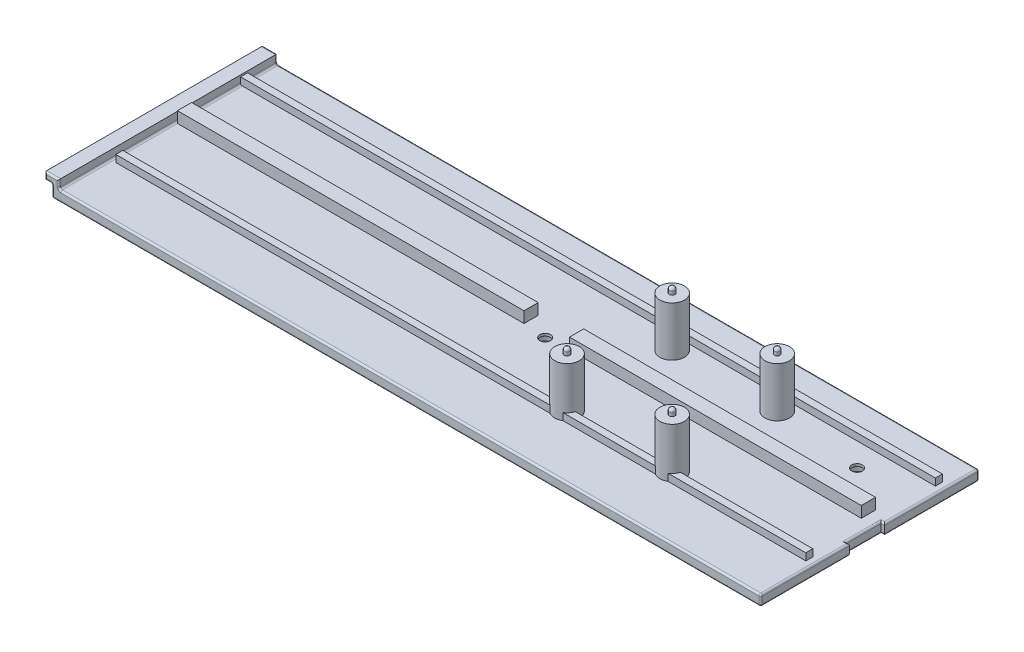
from build123d import *

# Parameters (mm, degrees)
SKETCH1_W                          = 202.32
SKETCH1_H                          = 62.3
LID_DEPTH                          = 2
SKETCH3_W                          = 2
SKETCH3_H                          = 62.3
LIP_VERTICAL_DEPTH                 = 2.5
SKETCH4_W                          = 62.3
SKETCH4_H                          = 2
LIP_HORIZONTAL_DEPTH               = 2
SKETCH11_W                         = 202.32
SKETCH11_H                         = 62.3
FATTEN_BELOW_DEPTH                 = 1
SKETCH19_W                         = 1
SKETCH19_H                         = 10
OPENER_HOLE_DEPTH                  = 214.147183995
FILLET1_R                          = 0.5
SKETCH2_W                          = 196.97
SKETCH2_H                          = 2
SKETCH2_W_2                        = 198.82
STIFFENERS_DEPTH                   = 2
SKETCH20_W                         = 195.199890547
SKETCH20_H                         = 4.052325692
CENTER_STIFFENER_DEPTH             = 3.161676403
SKETCH5_R                          = 1.524
MOUNTING_SCREW_HOLES_DEPTH         = 214.099667392
SKETCH6_R                          = 3.048
MOUNTING_SCREW_COUNTERSINK_DEPTH   = 2.286
SKETCH21_W                         = 13
SKETCH21_H                         = 13
CLEARANCE_FOR_ENCLOSURE_SNAP_DEPTH = 214.099667392
SKETCH7_R                          = 3.5
TRELLIS_BOSSES_DEPTH               = 14.161676403
SKETCH8_R                          = 0.8
TRELLIS_DOME_MOUNT_DEPTH           = 1
DOME1_FACE_RADIUS                  = 0.8
DOME1_HEIGHT                       = 0.8
DOME2_FACE_RADIUS                  = 0.8
DOME2_HEIGHT                       = 0.8
DOME3_FACE_RADIUS                  = 0.8
DOME3_HEIGHT                       = 0.8
DOME4_FACE_RADIUS                  = 0.8
DOME4_HEIGHT                       = 0.8
BOTTOM_SURFACE_DEPTH               = 12
FILL_START                         = 74.825598753
FILL_BOTTOM_DEPTH                  = 12
FILL_START_2                       = 83.485852791
FILL_BOTTOM_2_DEPTH                = 12
FILL_START_3                       = 92.146106828
FILL_BOTTOM_3_DEPTH                = 12
FILL_START_4                       = 48.844836639
FILL_BOTTOM_4_DEPTH                = 12
FILL_START_5                       = 57.505090677
FILL_BOTTOM_5_DEPTH                = 12
FILL_START_6                       = 66.165344715
FILL_BOTTOM_6_DEPTH                = 12


# Read off the part's stored shape, not the designer's step: fill bottom
with BuildPart() as part:
    # Sketch1 → lid (new body)
    with BuildSketch(Plane.XZ.offset(-34)):
        with Locations((80.631906678, 79.994836639)):
            Rectangle(SKETCH1_W, SKETCH1_H)
    extrude(amount=-LID_DEPTH)

    # Sketch3 → lip vertical (add)
    with BuildSketch(Plane(origin=(0, 36, 0), x_dir=(1, 0, 0), z_dir=(0, 1, 0))):
        with Locations((-19.528093322, -79.994836639)):
            Rectangle(SKETCH3_W, SKETCH3_H)
    extrude(amount=LIP_VERTICAL_DEPTH)

    # Sketch4 → lip horizontal (add)
    with BuildSketch(Plane.ZY.offset(20.528093322)):
        with Locations((79.994836639, 37.5)):
            Rectangle(SKETCH4_W, SKETCH4_H)
    extrude(amount=LIP_HORIZONTAL_DEPTH)

    # Sketch11 → fatten below (add)
    with BuildSketch(Plane.XZ.offset(-34)):
        with Locations((80.631906678, 79.994836639)):
            Rectangle(SKETCH11_W, SKETCH11_H)
    extrude(amount=FATTEN_BELOW_DEPTH)

    # Sketch19 → opener hole (cut, through all)
    with BuildSketch(Plane.XZ.offset(-33)):
        with Locations((181.291906678, 80.801378607)):
            Rectangle(SKETCH19_W, SKETCH19_H)
    extrude(amount=-OPENER_HOLE_DEPTH, mode=Mode.SUBTRACT)

    # Fillet1
    fillet1_edges = [part.edges().sort_by_distance(p)[0] for p in [
        (81.631906678, 36, 48.844836639),
        (-18.528093322, 36, 79.994836639),
        (-18.528093322, 37.25, 111.144836639),
        (-18.528093322, 37.25, 48.844836639),
        (-20.528093322, 38.5, 111.144836639),
        (-20.528093322, 38.5, 48.844836639),
        (181.791906678, 34.5, 48.844836639),
        (181.791906678, 36, 62.323107623),
        (181.791906678, 34.5, 111.144836639),
        (81.631906678, 36, 111.144836639),
        (-20.528093322, 34.75, 111.144836639),
        (-20.528093322, 34.75, 48.844836639),
        (-20.528093322, 36.5, 79.994836639),
        (-21.528093322, 36.5, 48.844836639),
        (-21.528093322, 36.5, 111.144836639),
        (-22.528093322, 37.5, 48.844836639),
        (-22.528093322, 37.5, 111.144836639),
        (-20.528093322, 33, 79.994836639),
        (80.631906678, 33, 48.844836639),
        (181.791906678, 33, 62.323107623),
        (80.631906678, 33, 111.144836639),
        (181.791906678, 33, 98.473107623),
        (181.791906678, 36, 98.473107623),
        (181.291906678, 36, 75.801378607),
        (180.791906678, 36, 80.801378607),
        (181.291906678, 36, 85.801378607),
        (181.291906678, 33, 85.801378607),
        (180.791906678, 33, 80.801378607),
        (181.291906678, 33, 75.801378607),
    ]]
    fillet(fillet1_edges, radius=FILLET1_R)

    # Sketch2 → stiffeners (add)
    with BuildSketch(Plane.XZ.offset(-36)):
        with Locations((81.306906678, 95.288805171)):
            Rectangle(SKETCH2_W, SKETCH2_H)
        with Locations((80.381906678, 58.308383304)):
            Rectangle(SKETCH2_W_2, SKETCH2_H)
    extrude(amount=-STIFFENERS_DEPTH)

    # Sketch20 → center stiffener (add)
    with BuildSketch(Plane(origin=(0, 36, 0), x_dir=(1, 0, 0), z_dir=(0, 1, 0))):
        with Locations((79.571851952, -75.814480957)):
            Rectangle(SKETCH20_W, SKETCH20_H)
    extrude(amount=CENTER_STIFFENER_DEPTH)

    # Sketch5 → mounting screw holes (cut, through all)
    with BuildSketch(Plane(origin=(0, 36, 0), x_dir=(1, 0, 0), z_dir=(0, 1, 0))):
        with Locations(Location((164.141906678, -66, 0), (0, 0, 270))):
            Circle(SKETCH5_R)
        with Locations(Location((87.4, -78.296377284, 0), (0, 0, 270))):
            Circle(SKETCH5_R)
    extrude(amount=-MOUNTING_SCREW_HOLES_DEPTH, mode=Mode.SUBTRACT)

    # Sketch6 → mounting screw countersink (cut)
    with BuildSketch(Plane.XZ.offset(-33)):
        with Locations(Location((164.141906678, 66, 0), (0, 0, 270))):
            Circle(SKETCH6_R)
        with Locations(Location((87.4, 78.296377284, 0), (0, 0, 270))):
            Circle(SKETCH6_R)
    extrude(amount=-MOUNTING_SCREW_COUNTERSINK_DEPTH, mode=Mode.SUBTRACT)

    # Sketch21 → clearance for enclosure snap (cut, through all)
    with BuildSketch(Plane(origin=(0, 36, 0), x_dir=(1, 0, 0), z_dir=(0, 1, 0))):
        with Locations((87.4, -78.296377284)):
            Rectangle(SKETCH21_W, SKETCH21_H)
    extrude(amount=CLEARANCE_FOR_ENCLOSURE_SNAP_DEPTH, mode=Mode.SUBTRACT)

    # Sketch7 → Trellis bosses (add)
    with BuildSketch(Plane(origin=(0, 36, 0), x_dir=(1, 0, 0), z_dir=(0, 1, 0))):
        with Locations(Location((108.641906678, -63.296377284, 0), (0, 0, 90))):
            Circle(SKETCH7_R)
        with Locations(Location((138.641906678, -63.296377284, 0), (0, 0, 90))):
            Circle(SKETCH7_R)
        with Locations(Location((108.641906678, -93.296377284, 0), (0, 0, 90))):
            Circle(SKETCH7_R)
        with Locations(Location((138.641906678, -93.296377284, 0), (0, 0, 90))):
            Circle(SKETCH7_R)
    extrude(amount=TRELLIS_BOSSES_DEPTH)

    # Sketch8 → trellis dome mount (add)
    with BuildSketch(Plane(origin=(0, 50.161676403, 0), x_dir=(1, 0, 0), z_dir=(0, 1, 0))):
        with Locations(Location((108.641906678, -63.296377284, 0), (0, 0, 270))):
            Circle(SKETCH8_R)
        with Locations(Location((138.641906678, -63.296377284, 0), (0, 0, 270))):
            Circle(SKETCH8_R)
        with Locations(Location((108.641906678, -93.296377284, 0), (0, 0, 270))):
            Circle(SKETCH8_R)
        with Locations(Location((138.641906678, -93.296377284, 0), (0, 0, 270))):
            Circle(SKETCH8_R)
    extrude(amount=TRELLIS_DOME_MOUNT_DEPTH)

    # Dome1: a dome of height H over a round flat face of radius A is a cap of a sphere of radius (A * A + H * H) / (2 * H)
    dome1_r = (DOME1_FACE_RADIUS * DOME1_FACE_RADIUS + DOME1_HEIGHT * DOME1_HEIGHT) / (2 * DOME1_HEIGHT)
    dome1_base = Plane((108.641906678, 51.161676403, 63.296377284), z_dir=(0, 1, 0))
    with Locations(dome1_base.offset(DOME1_HEIGHT - dome1_r)):
        dome1_ball = Sphere(dome1_r, mode=Mode.PRIVATE)
    add(split(dome1_ball, bisect_by=dome1_base, keep=Keep.TOP, mode=Mode.PRIVATE))

    # Dome2: a dome of height H over a round flat face of radius A is a cap of a sphere of radius (A * A + H * H) / (2 * H)
    dome2_r = (DOME2_FACE_RADIUS * DOME2_FACE_RADIUS + DOME2_HEIGHT * DOME2_HEIGHT) / (2 * DOME2_HEIGHT)
    dome2_base = Plane((108.641906678, 51.161676403, 93.296377284), z_dir=(0, 1, 0))
    with Locations(dome2_base.offset(DOME2_HEIGHT - dome2_r)):
        dome2_ball = Sphere(dome2_r, mode=Mode.PRIVATE)
    add(split(dome2_ball, bisect_by=dome2_base, keep=Keep.TOP, mode=Mode.PRIVATE))

    # Dome3: a dome of height H over a round flat face of radius A is a cap of a sphere of radius (A * A + H * H) / (2 * H)
    dome3_r = (DOME3_FACE_RADIUS * DOME3_FACE_RADIUS + DOME3_HEIGHT * DOME3_HEIGHT) / (2 * DOME3_HEIGHT)
    dome3_base = Plane((138.641906678, 51.161676403, 93.296377284), z_dir=(0, 1, 0))
    with Locations(dome3_base.offset(DOME3_HEIGHT - dome3_r)):
        dome3_ball = Sphere(dome3_r, mode=Mode.PRIVATE)
    add(split(dome3_ball, bisect_by=dome3_base, keep=Keep.TOP, mode=Mode.PRIVATE))

    # Dome4: a dome of height H over a round flat face of radius A is a cap of a sphere of radius (A * A + H * H) / (2 * H)
    dome4_r = (DOME4_FACE_RADIUS * DOME4_FACE_RADIUS + DOME4_HEIGHT * DOME4_HEIGHT) / (2 * DOME4_HEIGHT)
    dome4_base = Plane((138.641906678, 51.161676403, 63.296377284), z_dir=(0, 1, 0))
    with Locations(dome4_base.offset(DOME4_HEIGHT - dome4_r)):
        dome4_ball = Sphere(dome4_r, mode=Mode.PRIVATE)
    add(split(dome4_ball, bisect_by=dome4_base, keep=Keep.TOP, mode=Mode.PRIVATE))

    # Sketch15 → bottom surface (cut)
    with BuildSketch(Plane(origin=(0, 0, 48.844836639), x_dir=(-1, 0, 0), z_dir=(0, 0, -1))):
        Polygon((-56.203002414, 33.5), (-54.454472185, 31.287500136), (-58.415502277, 31.287500136), align=None)
    extrude(amount=-BOTTOM_SURFACE_DEPTH, mode=Mode.SUBTRACT)

    # fill bottom outline → fill bottom (cut)
    with BuildSketch(Plane.XY.offset(FILL_START)):
        Polygon((-19.192145685, 33), (-18.296997586, 33), (-18.796997586, 33.5), align=None)
        Polygon((-9.192145685, 33), (-8.296997586, 33), (-8.796997586, 33.5), align=None)
        Polygon((0.807854315, 33), (1.703002414, 33), (1.203002414, 33.5), align=None)
        Polygon((10.807854315, 33), (11.703002414, 33), (11.203002414, 33.5), align=None)
        Polygon((20.807854315, 33), (21.703002414, 33), (21.203002414, 33.5), align=None)
        Polygon((30.807854315, 33), (31.703002414, 33), (31.203002414, 33.5), align=None)
        Polygon((40.807854315, 33), (41.703002414, 33), (41.203002414, 33.5), align=None)
        Polygon((50.807854315, 33), (51.703002414, 33), (51.203002414, 33.5), align=None)
        Polygon((171.203002414, 33.5), (170.807854315, 33), (171.703002414, 33), align=None)
        Polygon((161.203002414, 33.5), (160.807854315, 33), (161.703002414, 33), align=None)
        Polygon((151.203002414, 33.5), (150.807854315, 33), (151.703002414, 33), align=None)
        Polygon((141.203002414, 33.5), (140.807854315, 33), (141.703002414, 33), align=None)
        Polygon((131.203002414, 33.5), (130.807854315, 33), (131.703002414, 33), align=None)
        Polygon((121.203002414, 33.5), (120.807854315, 33), (121.703002414, 33), align=None)
        Polygon((111.203002414, 33.5), (110.807854315, 33), (111.703002414, 33), align=None)
        Polygon((101.203002414, 33.5), (100.807854315, 33), (101.703002414, 33), align=None)
        Polygon((91.203002414, 33.5), (90.807854315, 33), (91.703002414, 33), align=None)
        Polygon((81.203002414, 33.5), (80.807854315, 33), (81.703002414, 33), align=None)
        Polygon((71.203002414, 33.5), (70.807854315, 33), (71.703002414, 33), align=None)
        Polygon((61.203002414, 33.5), (60.807854315, 33), (61.703002414, 33), align=None)
    extrude(amount=FILL_BOTTOM_DEPTH, mode=Mode.SUBTRACT)

    # fill bottom 2 outline → fill bottom 2 (cut)
    with BuildSketch(Plane.XY.offset(FILL_START_2)):
        Polygon((55.807854315, 33), (56.703002414, 33), (56.203002414, 33.5), align=None)
        Polygon((-14.192145685, 33), (-13.296997586, 33), (-13.796997586, 33.5), align=None)
        Polygon((-4.192145685, 33), (-3.296997586, 33), (-3.796997586, 33.5), align=None)
        Polygon((5.807854315, 33), (6.703002414, 33), (6.203002414, 33.5), align=None)
        Polygon((15.807854315, 33), (16.703002414, 33), (16.203002414, 33.5), align=None)
        Polygon((25.807854315, 33), (26.703002414, 33), (26.203002414, 33.5), align=None)
        Polygon((35.807854315, 33), (36.703002414, 33), (36.203002414, 33.5), align=None)
        Polygon((45.807854315, 33), (46.703002414, 33), (46.203002414, 33.5), align=None)
        Polygon((176.203002414, 33.5), (175.807854315, 33), (176.703002414, 33), align=None)
        Polygon((166.203002414, 33.5), (165.807854315, 33), (166.703002414, 33), align=None)
        Polygon((156.203002414, 33.5), (155.807854315, 33), (156.703002414, 33), align=None)
        Polygon((146.203002414, 33.5), (145.807854315, 33), (146.703002414, 33), align=None)
        Polygon((136.203002414, 33.5), (135.807854315, 33), (136.703002414, 33), align=None)
        Polygon((126.203002414, 33.5), (125.807854315, 33), (126.703002414, 33), align=None)
        Polygon((116.203002414, 33.5), (115.807854315, 33), (116.703002414, 33), align=None)
        Polygon((106.203002414, 33.5), (105.807854315, 33), (106.703002414, 33), align=None)
        Polygon((96.203002414, 33.5), (95.807854315, 33), (96.703002414, 33), align=None)
        Polygon((86.203002414, 33.5), (85.807854315, 33), (86.703002414, 33), align=None)
        Polygon((76.203002414, 33.5), (75.807854315, 33), (76.703002414, 33), align=None)
        Polygon((66.203002414, 33.5), (65.807854315, 33), (66.703002414, 33), align=None)
    extrude(amount=FILL_BOTTOM_2_DEPTH, mode=Mode.SUBTRACT)

    # fill bottom 3 outline → fill bottom 3 (cut)
    with BuildSketch(Plane.XY.offset(FILL_START_3)):
        Polygon((-19.192145685, 33), (-18.296997586, 33), (-18.796997586, 33.5), align=None)
        Polygon((-9.192145685, 33), (-8.296997586, 33), (-8.796997586, 33.5), align=None)
        Polygon((0.807854315, 33), (1.703002414, 33), (1.203002414, 33.5), align=None)
        Polygon((10.807854315, 33), (11.703002414, 33), (11.203002414, 33.5), align=None)
        Polygon((20.807854315, 33), (21.703002414, 33), (21.203002414, 33.5), align=None)
        Polygon((30.807854315, 33), (31.703002414, 33), (31.203002414, 33.5), align=None)
        Polygon((40.807854315, 33), (41.703002414, 33), (41.203002414, 33.5), align=None)
        Polygon((50.807854315, 33), (51.703002414, 33), (51.203002414, 33.5), align=None)
        Polygon((171.203002414, 33.5), (170.807854315, 33), (171.703002414, 33), align=None)
        Polygon((161.203002414, 33.5), (160.807854315, 33), (161.703002414, 33), align=None)
        Polygon((151.203002414, 33.5), (150.807854315, 33), (151.703002414, 33), align=None)
        Polygon((141.203002414, 33.5), (140.807854315, 33), (141.703002414, 33), align=None)
        Polygon((131.203002414, 33.5), (130.807854315, 33), (131.703002414, 33), align=None)
        Polygon((121.203002414, 33.5), (120.807854315, 33), (121.703002414, 33), align=None)
        Polygon((111.203002414, 33.5), (110.807854315, 33), (111.703002414, 33), align=None)
        Polygon((101.203002414, 33.5), (100.807854315, 33), (101.703002414, 33), align=None)
        Polygon((91.203002414, 33.5), (90.807854315, 33), (91.703002414, 33), align=None)
        Polygon((81.203002414, 33.5), (80.807854315, 33), (81.703002414, 33), align=None)
        Polygon((71.203002414, 33.5), (70.807854315, 33), (71.703002414, 33), align=None)
        Polygon((61.203002414, 33.5), (60.807854315, 33), (61.703002414, 33), align=None)
    extrude(amount=FILL_BOTTOM_3_DEPTH, mode=Mode.SUBTRACT)

    # fill bottom 4 outline → fill bottom 4 (cut)
    with BuildSketch(Plane.XY.offset(FILL_START_4)):
        Polygon((-14.192145685, 33), (-13.296997586, 33), (-13.796997586, 33.5), align=None)
        Polygon((-4.192145685, 33), (-3.296997586, 33), (-3.796997586, 33.5), align=None)
        Polygon((5.807854315, 33), (6.703002414, 33), (6.203002414, 33.5), align=None)
        Polygon((15.807854315, 33), (16.703002414, 33), (16.203002414, 33.5), align=None)
        Polygon((25.807854315, 33), (26.703002414, 33), (26.203002414, 33.5), align=None)
        Polygon((35.807854315, 33), (36.703002414, 33), (36.203002414, 33.5), align=None)
        Polygon((45.807854315, 33), (46.703002414, 33), (46.203002414, 33.5), align=None)
        Polygon((176.203002414, 33.5), (175.807854315, 33), (176.703002414, 33), align=None)
        Polygon((166.203002414, 33.5), (165.807854315, 33), (166.703002414, 33), align=None)
        Polygon((156.203002414, 33.5), (155.807854315, 33), (156.703002414, 33), align=None)
        Polygon((146.203002414, 33.5), (145.807854315, 33), (146.703002414, 33), align=None)
        Polygon((136.203002414, 33.5), (135.807854315, 33), (136.703002414, 33), align=None)
        Polygon((126.203002414, 33.5), (125.807854315, 33), (126.703002414, 33), align=None)
        Polygon((116.203002414, 33.5), (115.807854315, 33), (116.703002414, 33), align=None)
        Polygon((106.203002414, 33.5), (105.807854315, 33), (106.703002414, 33), align=None)
        Polygon((96.203002414, 33.5), (95.807854315, 33), (96.703002414, 33), align=None)
        Polygon((86.203002414, 33.5), (85.807854315, 33), (86.703002414, 33), align=None)
        Polygon((76.203002414, 33.5), (75.807854315, 33), (76.703002414, 33), align=None)
        Polygon((66.203002414, 33.5), (65.807854315, 33), (66.703002414, 33), align=None)
    extrude(amount=FILL_BOTTOM_4_DEPTH, mode=Mode.SUBTRACT)

    # fill bottom 5 outline → fill bottom 5 (cut)
    with BuildSketch(Plane.XY.offset(FILL_START_5)):
        Polygon((-19.192145685, 33), (-18.296997586, 33), (-18.796997586, 33.5), align=None)
        Polygon((-9.192145685, 33), (-8.296997586, 33), (-8.796997586, 33.5), align=None)
        Polygon((0.807854315, 33), (1.703002414, 33), (1.203002414, 33.5), align=None)
        Polygon((10.807854315, 33), (11.703002414, 33), (11.203002414, 33.5), align=None)
        Polygon((20.807854315, 33), (21.703002414, 33), (21.203002414, 33.5), align=None)
        Polygon((30.807854315, 33), (31.703002414, 33), (31.203002414, 33.5), align=None)
        Polygon((40.807854315, 33), (41.703002414, 33), (41.203002414, 33.5), align=None)
        Polygon((50.807854315, 33), (51.703002414, 33), (51.203002414, 33.5), align=None)
        Polygon((171.203002414, 33.5), (170.807854315, 33), (171.703002414, 33), align=None)
        Polygon((151.203002414, 33.5), (150.807854315, 33), (151.703002414, 33), align=None)
        Polygon((141.203002414, 33.5), (140.807854315, 33), (141.703002414, 33), align=None)
        Polygon((131.203002414, 33.5), (130.807854315, 33), (131.703002414, 33), align=None)
        Polygon((121.203002414, 33.5), (120.807854315, 33), (121.703002414, 33), align=None)
        Polygon((111.203002414, 33.5), (110.807854315, 33), (111.703002414, 33), align=None)
        Polygon((101.203002414, 33.5), (100.807854315, 33), (101.703002414, 33), align=None)
        Polygon((91.203002414, 33.5), (90.807854315, 33), (91.703002414, 33), align=None)
        Polygon((81.203002414, 33.5), (80.807854315, 33), (81.703002414, 33), align=None)
        Polygon((71.203002414, 33.5), (70.807854315, 33), (71.703002414, 33), align=None)
        Polygon((61.203002414, 33.5), (60.807854315, 33), (61.703002414, 33), align=None)
    extrude(amount=FILL_BOTTOM_5_DEPTH, mode=Mode.SUBTRACT)

    # fill bottom 6 outline → fill bottom 6 (cut)
    with BuildSketch(Plane.XY.offset(FILL_START_6)):
        Polygon((55.807854315, 33), (56.703002414, 33), (56.203002414, 33.5), align=None)
        Polygon((-14.192145685, 33), (-13.296997586, 33), (-13.796997586, 33.5), align=None)
        Polygon((-4.192145685, 33), (-3.296997586, 33), (-3.796997586, 33.5), align=None)
        Polygon((5.807854315, 33), (6.703002414, 33), (6.203002414, 33.5), align=None)
        Polygon((15.807854315, 33), (16.703002414, 33), (16.203002414, 33.5), align=None)
        Polygon((25.807854315, 33), (26.703002414, 33), (26.203002414, 33.5), align=None)
        Polygon((35.807854315, 33), (36.703002414, 33), (36.203002414, 33.5), align=None)
        Polygon((45.807854315, 33), (46.703002414, 33), (46.203002414, 33.5), align=None)
        Polygon((176.203002414, 33.5), (175.807854315, 33), (176.703002414, 33), align=None)
        Polygon((156.203002414, 33.5), (155.807854315, 33), (156.703002414, 33), align=None)
        Polygon((146.203002414, 33.5), (145.807854315, 33), (146.703002414, 33), align=None)
        Polygon((136.203002414, 33.5), (135.807854315, 33), (136.703002414, 33), align=None)
        Polygon((126.203002414, 33.5), (125.807854315, 33), (126.703002414, 33), align=None)
        Polygon((116.203002414, 33.5), (115.807854315, 33), (116.703002414, 33), align=None)
        Polygon((106.203002414, 33.5), (105.807854315, 33), (106.703002414, 33), align=None)
        Polygon((96.203002414, 33.5), (95.807854315, 33), (96.703002414, 33), align=None)
        Polygon((76.203002414, 33.5), (75.807854315, 33), (76.703002414, 33), align=None)
        Polygon((66.203002414, 33.5), (65.807854315, 33), (66.703002414, 33), align=None)
    extrude(amount=FILL_BOTTOM_6_DEPTH, mode=Mode.SUBTRACT)


solid = part.part
